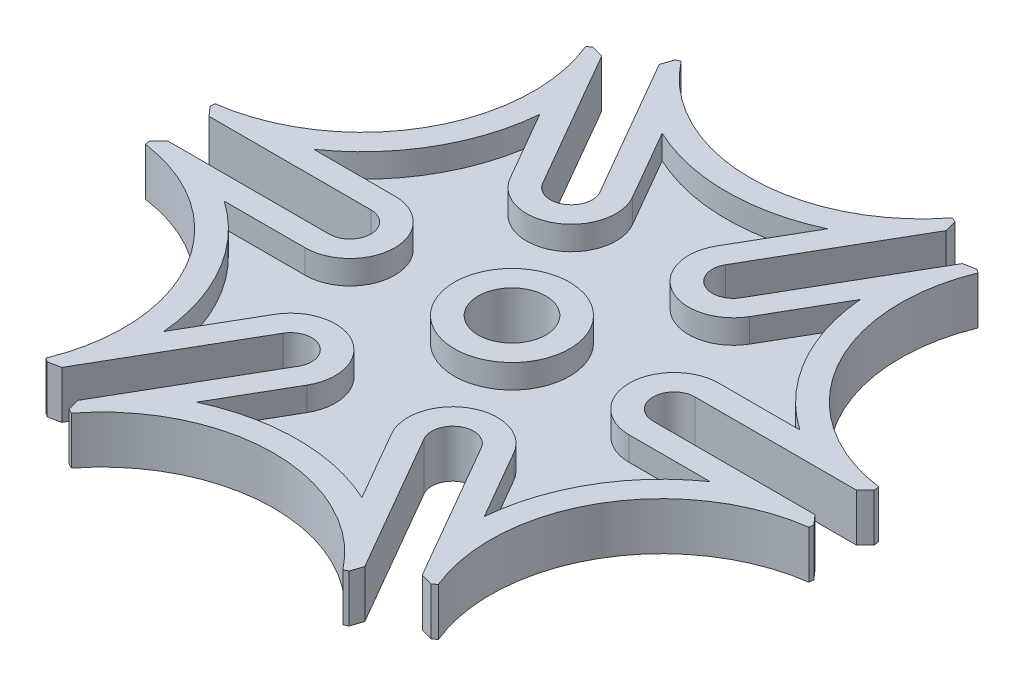
from build123d import *

# Parameters (mm, degrees)
SKETCH1_R           = 4.5085
BOSS_EXTRUDE1_DEPTH = 6.35
CHAMFER1_SIZE       = 1.27
CHAMFER1_SIZE_2     = 1.197119737
SHELL3_T            = -3.175
BOSS_EXTRUDE2_START = 6.604
SKETCH4_R           = 9.525
SKETCH4_R_2         = 4.5085
BOSS_EXTRUDE2_DEPTH = 6.604


with BuildPart() as part:
    # Sketch1 → Boss-Extrude1 (new body)
    with BuildSketch(Plane(origin=(0, 0, 0), x_dir=(1, 0, 0), z_dir=(0, 1, 0))):
        with BuildLine():
            ThreePointArc((-18.071873811, 40.610465116), (0, 31.75), (18.071873811, 40.610465116))
            ThreePointArc((18.071873811, 40.610465116), (18.920798217, 40.221957869), (19.761375854, 39.815707006))
            Line((19.761375854, 39.815707006), (8.375325022, 20.094488468))
            ThreePointArc((8.375325022, 20.094488468), (8.096203241, 17.974348056), (9.398, 16.27781349))
            ThreePointArc((9.398, 16.27781349), (11.518140412, 15.998691709), (13.214674978, 17.300488468))
            Line((13.214674978, 17.300488468), (24.60072581, 37.021707006))
            ThreePointArc((24.60072581, 37.021707006), (25.372838196, 36.49687085), (26.133757545, 35.955934372))
            ThreePointArc((26.133757545, 35.955934372), (27.49630657, 15.875), (44.205631356, 4.654530744))
            ThreePointArc((44.205631356, 4.654530744), (44.293636413, 3.725087019), (44.362101663, 2.794))
            Line((44.362101663, 2.794), (21.59, 2.794))
            ThreePointArc((21.59, 2.794), (19.614343653, 1.975656347), (18.796, 0))
            ThreePointArc((18.796, 0), (19.614343653, -1.975656347), (21.59, -2.794))
            Line((21.59, -2.794), (44.362101663, -2.794))
            ThreePointArc((44.362101663, -2.794), (44.293636413, -3.725087019), (44.205631356, -4.654530744))
            ThreePointArc((44.205631356, -4.654530744), (27.49630657, -15.875), (26.133757545, -35.955934372))
            ThreePointArc((26.133757545, -35.955934372), (25.372838196, -36.49687085), (24.60072581, -37.021707006))
            Line((24.60072581, -37.021707006), (13.214674978, -17.300488468))
            ThreePointArc((13.214674978, -17.300488468), (11.518140412, -15.998691709), (9.398, -16.27781349))
            ThreePointArc((9.398, -16.27781349), (8.096203241, -17.974348056), (8.375325022, -20.094488468))
            Line((8.375325022, -20.094488468), (19.761375854, -39.815707006))
            ThreePointArc((19.761375854, -39.815707006), (18.920798217, -40.221957869), (18.071873811, -40.610465116))
            ThreePointArc((18.071873811, -40.610465116), (0, -31.75), (-18.071873811, -40.610465116))
            ThreePointArc((-18.071873811, -40.610465116), (-18.920798217, -40.221957869), (-19.761375854, -39.815707006))
            Line((-19.761375854, -39.815707006), (-8.375325022, -20.094488468))
            ThreePointArc((-8.375325022, -20.094488468), (-8.096203241, -17.974348056), (-9.398, -16.27781349))
            ThreePointArc((-9.398, -16.27781349), (-11.518140412, -15.998691709), (-13.214674978, -17.300488468))
            Line((-13.214674978, -17.300488468), (-24.60072581, -37.021707006))
            ThreePointArc((-24.60072581, -37.021707006), (-25.372838196, -36.49687085), (-26.133757545, -35.955934372))
            ThreePointArc((-26.133757545, -35.955934372), (-27.49630657, -15.875), (-44.205631356, -4.654530744))
            ThreePointArc((-44.205631356, -4.654530744), (-44.293636413, -3.725087019), (-44.362101663, -2.794))
            Line((-44.362101663, -2.794), (-21.59, -2.794))
            ThreePointArc((-21.59, -2.794), (-19.614343653, -1.975656347), (-18.796, 0))
            ThreePointArc((-18.796, 0), (-19.614343653, 1.975656347), (-21.59, 2.794))
            Line((-21.59, 2.794), (-44.362101663, 2.794))
            ThreePointArc((-44.362101663, 2.794), (-44.293636413, 3.725087019), (-44.205631356, 4.654530744))
            ThreePointArc((-44.205631356, 4.654530744), (-27.49630657, 15.875), (-26.133757545, 35.955934372))
            ThreePointArc((-26.133757545, 35.955934372), (-25.372838196, 36.49687085), (-24.60072581, 37.021707006))
            Line((-24.60072581, 37.021707006), (-13.214674978, 17.300488468))
            ThreePointArc((-13.214674978, 17.300488468), (-11.518140412, 15.998691709), (-9.398, 16.27781349))
            ThreePointArc((-9.398, 16.27781349), (-8.096203241, 17.974348056), (-8.375325022, 20.094488468))
            Line((-8.375325022, 20.094488468), (-19.761375854, 39.815707006))
            ThreePointArc((-19.761375854, 39.815707006), (-18.920798217, 40.221957869), (-18.071873811, 40.610465116))
        make_face()
        with Locations(Location((0, 0, 0), (0, 0, 270))):
            Circle(SKETCH1_R, mode=Mode.SUBTRACT)
    extrude(amount=BOSS_EXTRUDE1_DEPTH)

    # Chamfer1
    # the kernel refuses this chamfer: 1.27, 1.197119737 mm, written as the material it takes off along each edge
    with BuildSketch(Plane(origin=(19.761375854, -3.266037395, -39.815707006), x_dir=(-0.5000000000000074, 0, 0.8660254037844344), z_dir=(0, 1, 0)), Plane(origin=(44.362101663, -3.266037395, -2.794), x_dir=(-1, 0, 0), z_dir=(0, 1, 0)), Plane(origin=(24.60072581, -3.266037395, 37.021707006), x_dir=(-0.49999999999999695, 0, -0.8660254037844405), z_dir=(0, 1, 0)), Plane(origin=(-19.761375854, -3.266037395, 39.815707006), x_dir=(0.5000000000000053, 0, -0.8660254037844356), z_dir=(0, 1, 0)), Plane(origin=(-44.362101663, -3.266037395, 2.794), x_dir=(1, 0, 0), z_dir=(0, 1, 0)), Plane(origin=(-24.60072581, -3.266037395, -37.021707006), x_dir=(0.4999999999999945, 0, 0.8660254037844418), z_dir=(0, 1, 0))) as chamfer1_piece_1:
        with BuildLine():
            Line((CHAMFER1_SIZE, 0), (0.090094948, -1.179905052))
            ThreePointArc((0.090094948, -1.179905052), (0.042382893, -0.606739351), (0, 0))
            Line((0, 0), (CHAMFER1_SIZE, 0))
        make_face()
    extrude(amount=12.882074789, mode=Mode.SUBTRACT)
    with BuildSketch(Plane(origin=(24.60072581, -3.221012361, -37.021707006), x_dir=(0.8250043252852427, 0, 0.5651264135223565), z_dir=(0, 1, 0)), Plane(origin=(44.362101663, -3.221012361, 2.794), x_dir=(-0.07691166781732867, 0, 0.9970379106902391), z_dir=(0, 1, 0)), Plane(origin=(19.761375854, -3.221012361, 39.815707006), x_dir=(-0.9019159931025786, 0, 0.4319114971678681), z_dir=(0, 1, 0)), Plane(origin=(-24.60072581, -3.221012361, 37.021707006), x_dir=(-0.8250043252852418, 0, -0.5651264135223576), z_dir=(0, 1, 0)), Plane(origin=(-44.362101663, -3.221012361, -2.794), x_dir=(0.07691166781734438, 0, -0.9970379106902378), z_dir=(0, 1, 0)), Plane(origin=(-19.761375854, -3.221012361, -39.815707006), x_dir=(0.9019159931025836, 0, -0.4319114971678576), z_dir=(0, 1, 0))) as chamfer1_piece_2:
        with BuildLine():
            Line((1.252478609, 0), (CHAMFER1_SIZE_2 * 0.0769116677883, -CHAMFER1_SIZE_2 * 0.997037910314))
            Line((CHAMFER1_SIZE_2 * 0.0769116677883, -CHAMFER1_SIZE_2 * 0.997037910314), (0, 0))
            ThreePointArc((0, 0), (0.643939498, 0.00440812), (1.252478609, 0))
        make_face()
    extrude(amount=12.792024723, mode=Mode.SUBTRACT)

    # Shell3
    shell3_openings = [part.faces().sort_by_distance(p)[0] for p in [
        (-17.59446424, 6.35, 0),
    ]]
    offset(amount=SHELL3_T, openings=shell3_openings)

    # Sketch4 → Boss-Extrude2 (add)
    with BuildSketch(Plane.XZ.offset(BOSS_EXTRUDE2_START)):
        with Locations(Location((0, 0, 0), (0, 0, 90))):
            Circle(SKETCH4_R)
        with Locations(Location((0, 0, 0), (0, 0, 270))):
            Circle(SKETCH4_R_2, mode=Mode.SUBTRACT)
    extrude(amount=-BOSS_EXTRUDE2_DEPTH)


solid = part.part
